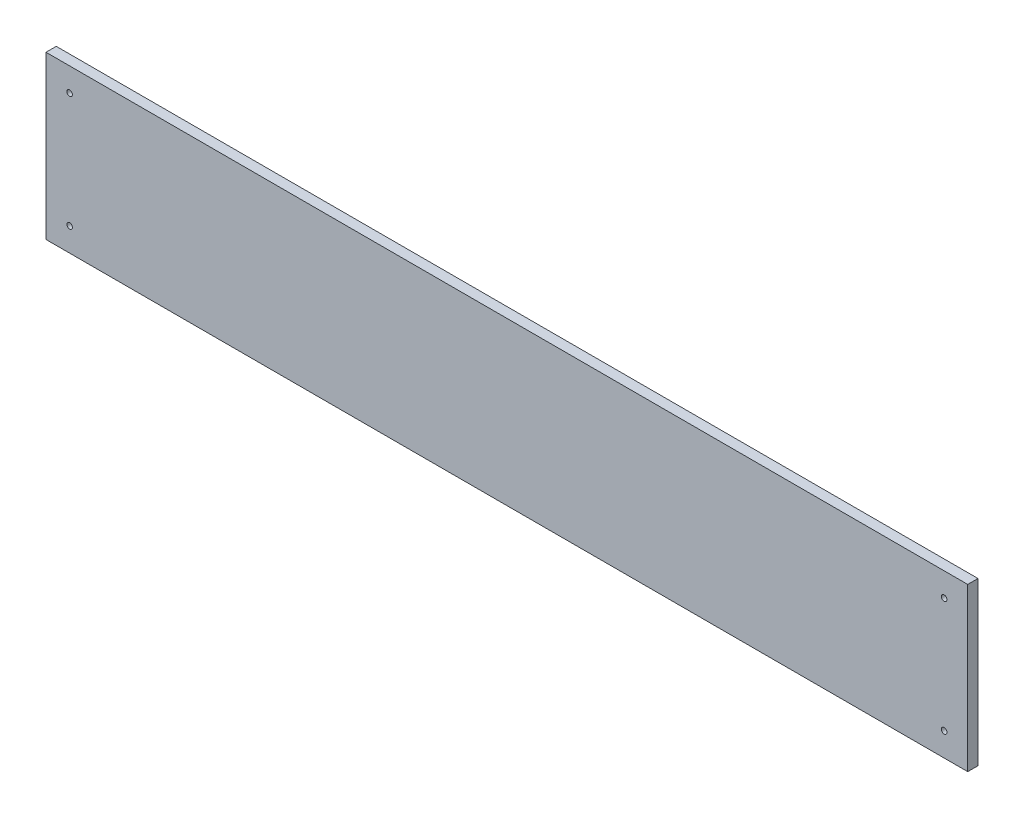
from build123d import *

# Parameters (mm, degrees)
SKETCH_F_W                   = 449
SKETCH_F_H                   = 79
SKETCH_F_R                   = 1.361667817
ESTRUSIONE_ESTRUSIONE1_DEPTH = 5


with BuildPart() as part:
    # Sketch f → Estrusione-Estrusione1 (new body)
    with BuildSketch(Plane.XY):
        with Locations((224.5, 39.5)):
            Rectangle(SKETCH_F_W, SKETCH_F_H)
        with Locations((11.5, 67.5)):
            Circle(SKETCH_F_R, mode=Mode.SUBTRACT)
        with Locations((437.5, 67.5)):
            Circle(SKETCH_F_R, mode=Mode.SUBTRACT)
        with Locations((11.5, 11.5)):
            Circle(SKETCH_F_R, mode=Mode.SUBTRACT)
        with Locations((437.5, 11.5)):
            Circle(SKETCH_F_R, mode=Mode.SUBTRACT)
    extrude(amount=ESTRUSIONE_ESTRUSIONE1_DEPTH)


solid = part.part
